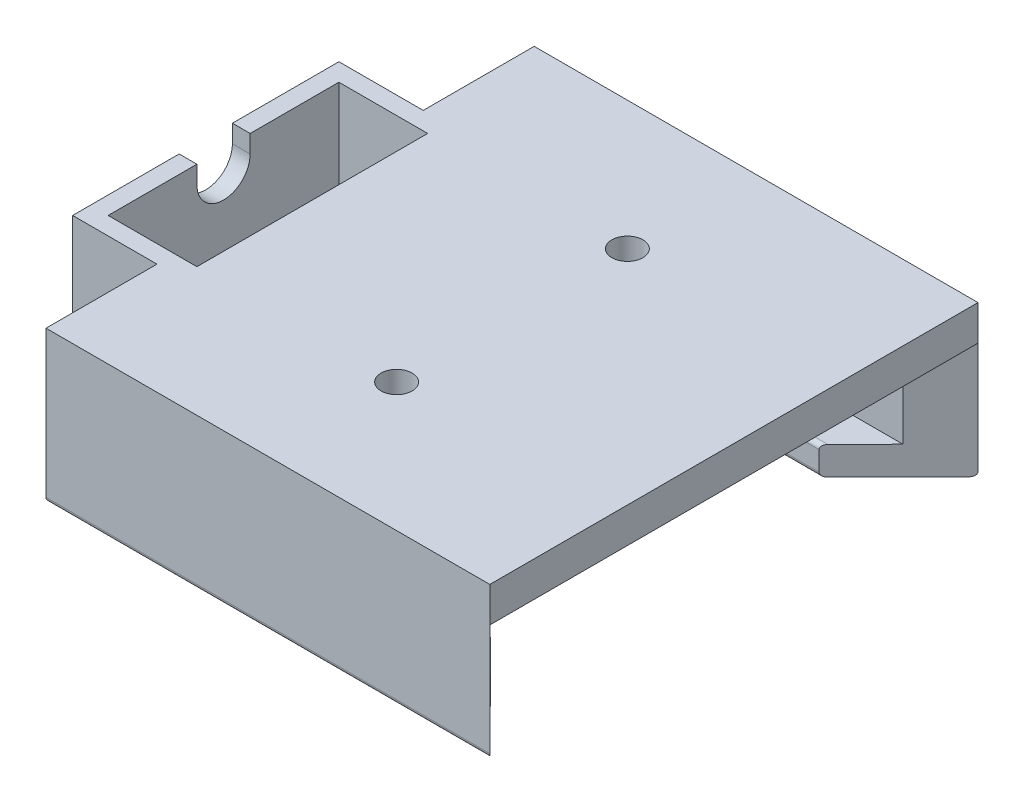
from build123d import *

# Parameters (mm, degrees)
SKETCH_1_W          = 50
SKETCH_1_H          = 55
EXTRUDE_1_DEPTH     = 6
SKETCH_2_W          = 15
SKETCH_2_H          = 30
EXTRUDE_2_DEPTH     = 9
SKETCH_3_W          = 15
SKETCH_3_H          = 1
CUT_EXTRUDE_1_DEPTH = 7
SKETCH_4_W          = 50
SKETCH_4_H          = 4.25
EXTRUDE_3_DEPTH     = 9.5
SKETCH_5_W          = 50
SKETCH_5_H          = 3.7
EXTRUDE_4_DEPTH     = 4.75
CUT_EXTRUDE_2_DEPTH = 9.5
SKETCH_7_W          = 30
SKETCH_7_H          = 15
EXTRUDE_5_DEPTH     = 9.5
SKETCH_8_W          = 10
SKETCH_8_H          = 26
CUT_EXTRUDE_3_DEPTH = 10.5
SKETCH_9_R          = 3
CUT_EXTRUDE_4_DEPTH = 7.5
SKETCH_10_R         = 1.75
CUT_EXTRUDE_5_DEPTH = 7.5
CHAMFER_1_SIZE      = 4
SKETCH_11_R         = 1.75
EXTRUDE_6_DEPTH     = 2
SKETCH_12_W         = 89.739519214
SKETCH_12_H         = 69.095216672
CUT_EXTRUDE_6_DEPTH = 0.5
CHAMFER_2_SIZE      = 7
CHAMFER_2_SIZE_2    = 4.041451884
FILLET_1_R          = 0.5


with BuildPart() as part:
    # Эскиз1 → Бобышка-Вытянуть1 (new body)
    with BuildSketch(Plane(origin=(0, 0, 0), x_dir=(1, 0, 0), z_dir=(0, 1, 0))):
        Rectangle(SKETCH_1_W, SKETCH_1_H)
    extrude(amount=EXTRUDE_1_DEPTH)

    # Эскиз2 → Бобышка-Вытянуть2 (add)
    with BuildSketch(Plane.XZ):
        with Locations((-17.5, 0)):
            Rectangle(SKETCH_2_W, SKETCH_2_H)
    extrude(amount=EXTRUDE_2_DEPTH)

    # Эскиз3 → Вырез-Вытянуть1 (cut)
    with BuildSketch(Plane.XZ.offset(9)):
        with Locations((-17.5, 12)):
            Rectangle(SKETCH_3_W, SKETCH_3_H)
        with Locations((-17.5, -12)):
            Rectangle(SKETCH_3_W, SKETCH_3_H)
    extrude(amount=-CUT_EXTRUDE_1_DEPTH, mode=Mode.SUBTRACT)

    # Эскиз4 → Бобышка-Вытянуть3 (add)
    with BuildSketch(Plane.XZ):
        with Locations((0, -25.375)):
            Rectangle(SKETCH_4_W, SKETCH_4_H)
        with Locations((0, 25.375)):
            Rectangle(SKETCH_4_W, SKETCH_4_H)
    extrude(amount=EXTRUDE_3_DEPTH)

    # Эскиз5 → Бобышка-Вытянуть4 (add)
    with BuildSketch(Plane(origin=(0, 0, 23.25), x_dir=(-1, 0, 0), z_dir=(0, 0, -1))):
        with Locations((0, -7.65)):
            Rectangle(SKETCH_5_W, SKETCH_5_H)
    extrude_4 = extrude(amount=EXTRUDE_4_DEPTH)

    # Зеркальное отражение1: Бобышка-Вытянуть4 across plane
    add(extrude_4.mirror(Plane.XY))

    # Эскиз6 → Вырез-Вытянуть2 (cut)
    with BuildSketch(Plane.XZ):
        Polygon((16.087749561, -18.5), (25, -27.5), (25, -18.5), align=None)
        Polygon((25, 18.5), (16.087749561, 18.5), (25, 27.5), align=None)
    extrude(amount=CUT_EXTRUDE_2_DEPTH, mode=Mode.SUBTRACT)

    # Эскиз7 → Бобышка-Вытянуть5 (add)
    with BuildSketch(Plane.ZY.offset(25)):
        with Locations((0, -1.5)):
            Rectangle(SKETCH_7_W, SKETCH_7_H)
    extrude(amount=EXTRUDE_5_DEPTH)

    # Эскиз8 → Вырез-Вытянуть3 (cut)
    with BuildSketch(Plane(origin=(0, 6, 0), x_dir=(1, 0, 0), z_dir=(0, 1, 0))):
        with Locations((-27.5, 0)):
            Rectangle(SKETCH_8_W, SKETCH_8_H)
    extrude(amount=-CUT_EXTRUDE_3_DEPTH, mode=Mode.SUBTRACT)

    # Эскиз9 → Вырез-Вытянуть4 (cut)
    with BuildSketch(Plane.ZY.offset(34.5)):
        with Locations((0, 6)):
            Circle(SKETCH_9_R)
    extrude(amount=-CUT_EXTRUDE_4_DEPTH, mode=Mode.SUBTRACT)

    # Эскиз10 → Вырез-Вытянуть5 (cut)
    with BuildSketch(Plane.XZ):
        with Locations(Location((0, 13, 0), (0, 0, 270))):
            Circle(SKETCH_10_R)
        with Locations(Location((0, -13, 0), (0, 0, 270))):
            Circle(SKETCH_10_R)
    extrude(amount=-CUT_EXTRUDE_5_DEPTH, mode=Mode.SUBTRACT)

    # Фаска1
    chamfer_1_edges = [part.edges().sort_by_distance(p)[0] for p in [
        (0, 0, 14.75),
        (0, 0, -11.25),
    ]]
    chamfer(chamfer_1_edges, length=CHAMFER_1_SIZE)

    # Эскиз11 → Бобышка-Вытянуть6 (add)
    with BuildSketch(Plane(origin=(0, 6, 0), x_dir=(1, 0, 0), z_dir=(0, 1, 0))):
        Polygon((-34.5, 3), (-32.5, 3), (-32.5, 13), (-22.5, 13), (-22.5, -13), (-32.5, -13), (-32.5, -3), (-34.5, -3), (-34.5, -15), (-25, -15), (-25, -27.5), (25, -27.5), (25, 27.5), (-25, 27.5), (-25, 15), (-34.5, 15), align=None)
        with Locations(Location((0, 13, 0), (0, 0, 90))):
            Circle(SKETCH_11_R, mode=Mode.SUBTRACT)
        with Locations(Location((0, -13, 0), (0, 0, 90))):
            Circle(SKETCH_11_R, mode=Mode.SUBTRACT)
    extrude(amount=EXTRUDE_6_DEPTH)

    # Эскиз12 → Вырез-Вытянуть6 (cut)
    with BuildSketch(Plane.XZ.offset(9.5)):
        with Locations((1.274872697, 1.26393689)):
            Rectangle(SKETCH_12_W, SKETCH_12_H)
    extrude(amount=-CUT_EXTRUDE_6_DEPTH, mode=Mode.SUBTRACT)

    # Фаска2
    # the kernel refuses this chamfer: 7, 4.041451884 mm, written as the material it takes off along each edge
    with BuildSketch(Plane(origin=(25, 0, 45.609600283), x_dir=(-0.9998132206222079, -0.019326765612700747, 0), z_dir=(0, 0, -1))) as chamfer_2_piece_1_section:
        Polygon((CHAMFER_2_SIZE * 0.999813220622, CHAMFER_2_SIZE * 0.0193267656127), (-CHAMFER_2_SIZE_2 * 0.0193267656143, CHAMFER_2_SIZE_2 * 0.999813220703), (0, 0), align=None)
    chamfer_2_piece_1 = extrude(amount=91.219200565, mode=Mode.PRIVATE)
    chamfer_2_piece_1 = split(chamfer_2_piece_1, bisect_by=Plane(origin=(23.020268738, 1.666507019, 25.500776405), z_dir=(0.7105622702047159, 0, -0.7036343227568711)), keep=Keep.TOP, mode=Mode.PRIVATE)
    chamfer_2_piece_1 = split(chamfer_2_piece_1, bisect_by=Plane(origin=(23.772949655, 1.666507019, -23.25), z_dir=(0, 0, 1)), keep=Keep.TOP, mode=Mode.PRIVATE)
    add(chamfer_2_piece_1, mode=Mode.SUBTRACT)
    with BuildSketch(Plane(origin=(25, 0, 45.609600283), x_dir=(-0.9998132206222079, -0.019326765612700747, 0), z_dir=(0, 0, -1))) as chamfer_2_piece_2_section:
        Polygon((CHAMFER_2_SIZE * 0.999813220622, CHAMFER_2_SIZE * 0.0193267656127), (-CHAMFER_2_SIZE_2 * 0.0193267656143, CHAMFER_2_SIZE_2 * 0.999813220703), (0, 0), align=None)
    chamfer_2_piece_2 = extrude(amount=91.219200565, mode=Mode.PRIVATE)
    chamfer_2_piece_2 = split(chamfer_2_piece_2, bisect_by=Plane(origin=(-2.796120558, 0.402909268, 0.569799735), z_dir=(0.7105622702047159, 0, 0.7036343227568711)), keep=Keep.TOP, mode=Mode.PRIVATE)
    chamfer_2_piece_2 = split(chamfer_2_piece_2, bisect_by=Plane(origin=(19.395718646, 0.402909268, 23.25), z_dir=(0, 0, -1)), keep=Keep.TOP, mode=Mode.PRIVATE)
    add(chamfer_2_piece_2, mode=Mode.SUBTRACT)

    # Скругление1
    fillet_1_edges = [part.edges().sort_by_distance(p)[0] for p in [
        (0, -9, 27.5),
        (-4.45612522, -9, 18.5),
        (-4.45612522, -9, -18.5),
        (0, -9, -27.5),
        (-4.45612522, -5.8, 18.5),
        (-4.45612522, -5.8, -18.5),
    ]]
    fillet(fillet_1_edges, radius=FILLET_1_R)


solid = part.part
